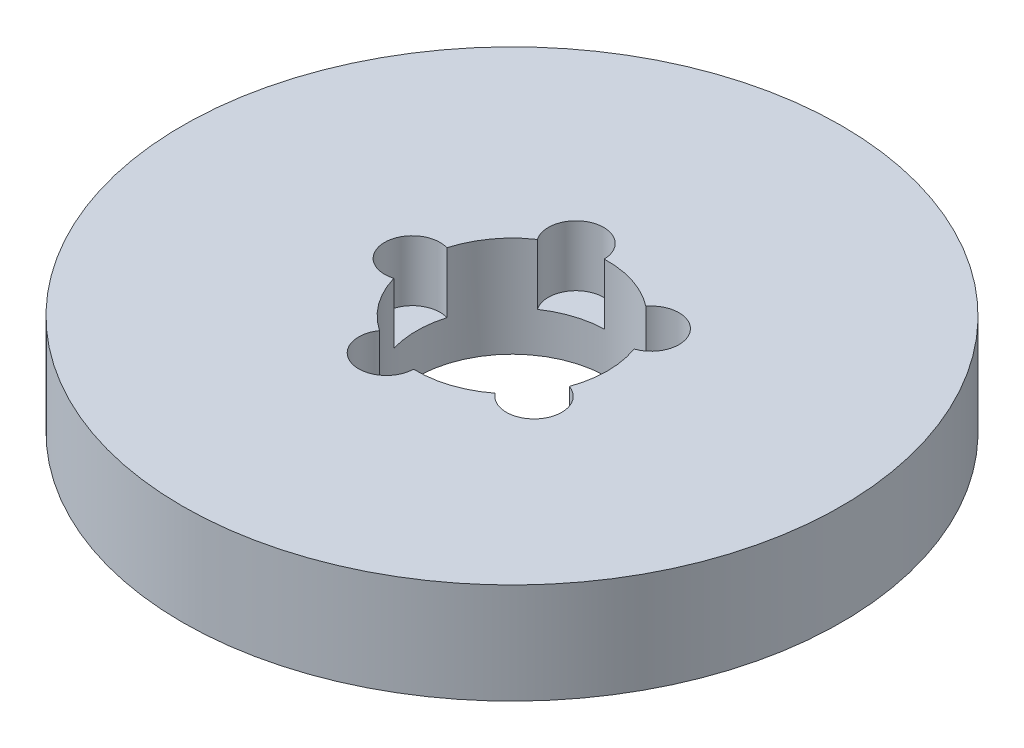
from build123d import *

# Parameters (mm, degrees)
SKETCH1_R           = 95
BOSS_EXTRUDE1_DEPTH = 29
SKETCH2_R           = 27.5
CUT_EXTRUDE1_DEPTH  = 138.444534267
SKETCH3_R           = 7.990236799
CUT_EXTRUDE2_DEPTH  = 17.457727715
CIRPATTERN1_COUNT   = 5


with BuildPart() as part:
    # Sketch1 → Boss-Extrude1 (new body)
    with BuildSketch(Plane(origin=(0, 0, 0), x_dir=(1, 0, 0), z_dir=(0, 1, 0))):
        Circle(SKETCH1_R)
    extrude(amount=BOSS_EXTRUDE1_DEPTH)

    # Sketch2 → Cut-Extrude1 (cut, through all)
    with BuildSketch(Plane(origin=(0, 0, 0), x_dir=(1, 0, 0), z_dir=(0, 1, 0))):
        Circle(SKETCH2_R)
    extrude(amount=CUT_EXTRUDE1_DEPTH, mode=Mode.SUBTRACT)

    # Sketch3 → Cut-Extrude2 (cut)
    with BuildSketch(Plane(origin=(0, 29, 0), x_dir=(1, 0, 0), z_dir=(0, 1, 0))):
        with Locations((-28.740120418, 0)):
            Circle(SKETCH3_R)
    cut_extrude2 = extrude(amount=-CUT_EXTRUDE2_DEPTH, mode=Mode.SUBTRACT)

    # CirPattern1: Cut-Extrude2 ×5 about axis
    cirpattern1_axis = Axis((0, 0, 0), (0, 1, 0))
    for i in range(1, CIRPATTERN1_COUNT):
        add(cut_extrude2.rotate(cirpattern1_axis, i * 360 / CIRPATTERN1_COUNT), mode=Mode.SUBTRACT)


solid = part.part
